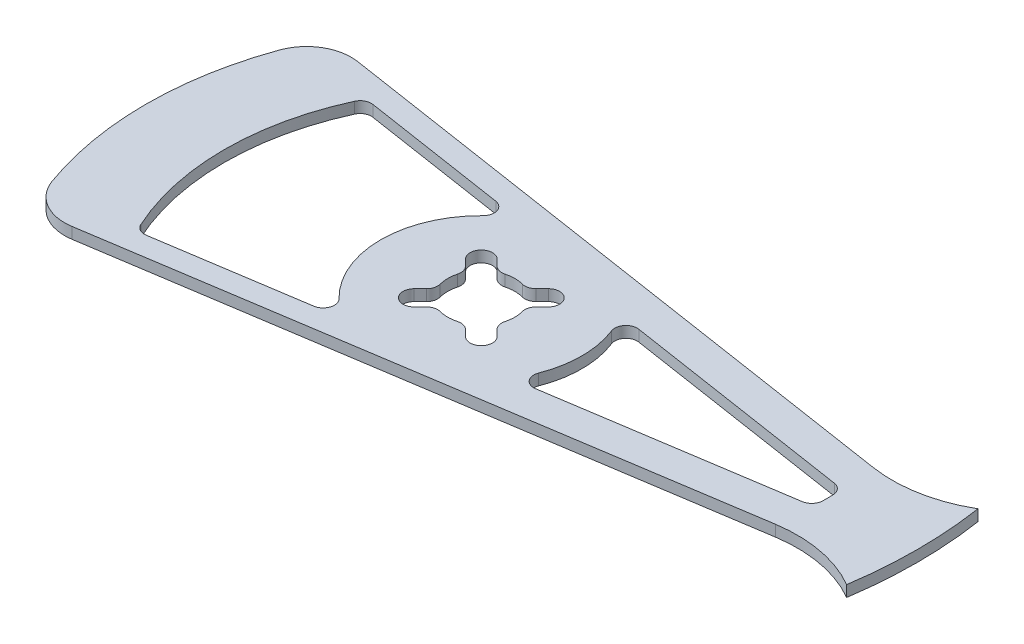
from build123d import *

# Parameters (mm, degrees)
BOSS_EXTRUDE1_DEPTH = 6.35
FILLET1_R           = 6.35
FILLET2_R           = 25.4
FILLET3_R           = 6.35


with BuildPart() as part:
    # Sketch1 → Boss-Extrude1 (new body)
    with BuildSketch(Plane(origin=(0, 0, 0), x_dir=(1, 0, 0), z_dir=(0, 1, 0))):
        with BuildLine():
            Line((194.872934042, 27.82915877), (-170.916556976, 84.129546246))
            ThreePointArc((-170.916556976, 84.129546246), (-190.5, 0), (-170.916556976, -84.129546246))
            Line((-170.916556976, -84.129546246), (194.872934042, -27.82915877))
            ThreePointArc((194.872934042, -27.82915877), (220.662117475, -28.27659702), (244.824613145, -37.301894031))
            ThreePointArc((244.824613145, -37.301894031), (247.65, 0), (244.824613145, 37.301894031))
            ThreePointArc((244.824613145, 37.301894031), (220.662117475, 28.27659702), (194.872934042, 27.82915877))
        make_face()
        with BuildLine():
            ThreePointArc((-130.60870167, -65.076024595), (-145.923, 0), (-130.60870167, 65.076024595))
            Line((-130.60870167, 65.076024595), (-28.741073501, 49.39709702))
            ThreePointArc((-28.741073501, 49.39709702), (-57.15, 0), (-28.741073501, -49.39709702))
            Line((-28.741073501, -49.39709702), (-130.60870167, -65.076024595))
        make_face(mode=Mode.SUBTRACT)
        with BuildLine():
            Line((-17.190128061, 8.209871939), (-23.540128061, 14.559871939))
            ThreePointArc((-23.540128061, 14.559871939), (-23.540128061, 23.540128061), (-14.559871939, 23.540128061))
            Line((-14.559871939, 23.540128061), (-8.209871939, 17.190128061))
            ThreePointArc((-8.209871939, 17.190128061), (0, 19.05), (8.209871939, 17.190128061))
            Line((8.209871939, 17.190128061), (14.559871939, 23.540128061))
            ThreePointArc((14.559871939, 23.540128061), (21.480039796, 24.916635031), (25.4, 19.05))
            ThreePointArc((25.4, 19.05), (24.916635031, 16.619960204), (23.540128061, 14.559871939))
            Line((23.540128061, 14.559871939), (17.190128061, 8.209871939))
            ThreePointArc((17.190128061, 8.209871939), (18.579214724, 4.20895239), (19.05, 0))
            ThreePointArc((19.05, 0), (18.579214724, -4.20895239), (17.190128061, -8.209871939))
            Line((17.190128061, -8.209871939), (23.540128061, -14.559871939))
            ThreePointArc((23.540128061, -14.559871939), (24.916635031, -16.619960204), (25.4, -19.05))
            ThreePointArc((25.4, -19.05), (21.480039796, -24.916635031), (14.559871939, -23.540128061))
            Line((14.559871939, -23.540128061), (8.209871939, -17.190128061))
            ThreePointArc((8.209871939, -17.190128061), (0, -19.05), (-8.209871939, -17.190128061))
            Line((-8.209871939, -17.190128061), (-14.559871939, -23.540128061))
            ThreePointArc((-14.559871939, -23.540128061), (-23.540128061, -23.540128061), (-23.540128061, -14.559871939))
            Line((-23.540128061, -14.559871939), (-17.190128061, -8.209871939))
            ThreePointArc((-17.190128061, -8.209871939), (-19.05, 0), (-17.190128061, 8.209871939))
        make_face(mode=Mode.SUBTRACT)
        with BuildLine():
            ThreePointArc((47.897230141, -31.17655922), (57.15, 0), (47.897230141, 31.17655922))
            Line((47.897230141, 31.17655922), (196.675896516, 8.277332285))
            ThreePointArc((196.675896516, 8.277332285), (196.85, 0), (196.675896516, -8.277332285))
            Line((196.675896516, -8.277332285), (47.897230141, -31.17655922))
        make_face(mode=Mode.SUBTRACT)
    extrude(amount=BOSS_EXTRUDE1_DEPTH)

    # Fillet1
    fillet1_edges = [part.edges().sort_by_distance(p)[0] for p in [
        (47.897230141, 3.175, 31.17655922),
        (47.897230141, 3.175, -31.17655922),
        (196.675896516, 3.175, -8.277332285),
        (196.675896516, 3.175, 8.277332285),
        (-130.60870167, 3.175, -65.076024595),
        (-130.60870167, 3.175, 65.076024595),
        (-28.741073501, 3.175, -49.39709702),
        (-28.741073501, 3.175, 49.39709702),
    ]]
    fillet(fillet1_edges, radius=FILLET1_R)

    # Fillet2
    fillet2_edges = [part.edges().sort_by_distance(p)[0] for p in [
        (-170.916556976, 3.175, -84.129546246),
        (-170.916556976, 3.175, 84.129546246),
    ]]
    fillet(fillet2_edges, radius=FILLET2_R)

    # Fillet3
    fillet3_edges = [part.edges().sort_by_distance(p)[0] for p in [
        (-8.209871939, 3.175, 17.190128061),
        (8.209871939, 3.175, 17.190128061),
        (17.190128061, 3.175, 8.209871939),
        (17.190128061, 3.175, -8.209871939),
        (-8.209871939, 3.175, -17.190128061),
        (8.209871939, 3.175, -17.190128061),
        (-17.190128061, 3.175, -8.209871939),
        (-17.190128061, 3.175, 8.209871939),
    ]]
    fillet(fillet3_edges, radius=FILLET3_R)


solid = part.part
